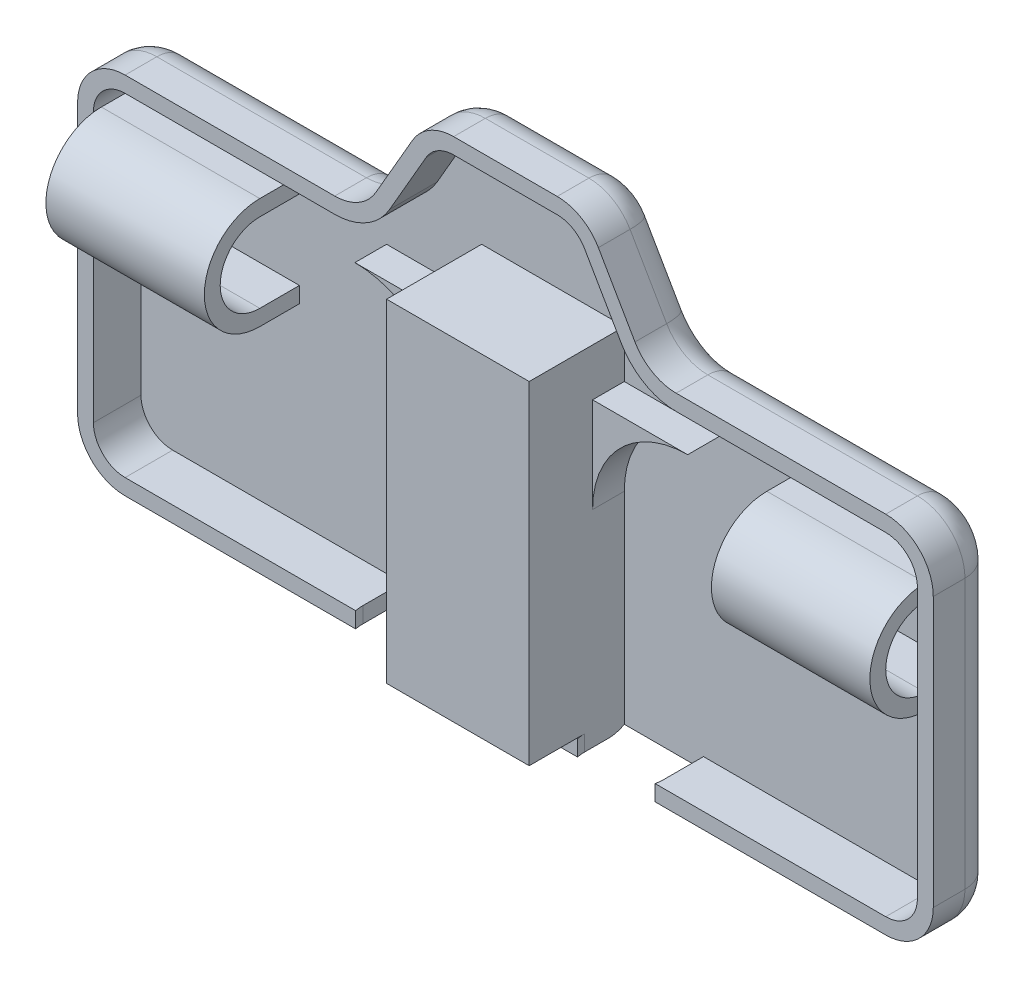
from build123d import *

# Parameters (mm, degrees)
BOSS_EXTRUDE1_DEPTH = 4
SHELL1_T            = -1
BOSS_EXTRUDE2_START = -26
BOSS_EXTRUDE2_DEPTH = 10
BOSS_EXTRUDE3_START = 16
BOSS_EXTRUDE3_DEPTH = 10
BOSS_EXTRUDE5_DEPTH = 2
SKETCH4_3_W         = 9
SKETCH4_3_H         = 21
BOSS_EXTRUDE6_DEPTH = 6
CUT_EXTRUDE1_REACH  = 35.47
FILLET1_R           = 2


with BuildPart() as part:
    # Sketch2 → Boss-Extrude1 (new body)
    with BuildSketch(Plane.XY):
        with BuildLine():
            Line((-3.267949192, 18.5), (3.267949192, 18.5))
            ThreePointArc((3.267949192, 18.5), (4.767949192, 18.098076211), (5.866025404, 17))
            Line((5.866025404, 17), (8.175426481, 13))
            ThreePointArc((8.175426481, 13), (9.273502692, 11.901923789), (10.773502692, 11.5))
            Line((10.773502692, 11.5), (24, 11.5))
            ThreePointArc((24, 11.5), (26.121320344, 10.621320344), (27, 8.5))
            Line((27, 8.5), (27, -8.5))
            ThreePointArc((27, -8.5), (26.121320344, -10.621320344), (24, -11.5))
            Line((24, -11.5), (-24, -11.5))
            ThreePointArc((-24, -11.5), (-26.121320344, -10.621320344), (-27, -8.5))
            Line((-27, -8.5), (-27, 8.5))
            ThreePointArc((-27, 8.5), (-26.121320344, 10.621320344), (-24, 11.5))
            Line((-24, 11.5), (-10.773502692, 11.5))
            ThreePointArc((-10.773502692, 11.5), (-9.273502692, 11.901923789), (-8.175426481, 13))
            Line((-8.175426481, 13), (-5.866025404, 17))
            ThreePointArc((-5.866025404, 17), (-4.767949192, 18.098076211), (-3.267949192, 18.5))
        make_face()
    extrude(amount=BOSS_EXTRUDE1_DEPTH)

    # Shell1
    shell1_openings = [part.faces().sort_by_distance(p)[0] for p in [
        (0, 1.077008716, 4),
    ]]
    offset(amount=SHELL1_T, openings=shell1_openings, kind=Kind.INTERSECTION)

    # Sketch3 → Boss-Extrude2 (add)
    with BuildSketch(Plane(origin=(0, 0, 0), x_dir=(0, 0, -1), z_dir=(1, 0, 0)).offset(BOSS_EXTRUDE2_START)):
        with BuildLine():
            Line((-1, 2.5), (-3.5, 2.5))
            ThreePointArc((-3.5, 2.5), (-6, 5), (-3.5, 7.5))
            Line((-3.5, 7.5), (-1, 7.5))
            Line((-1, 7.5), (-1, 8.5))
            Line((-1, 8.5), (-3.5, 8.5))
            ThreePointArc((-3.5, 8.5), (-7, 5), (-3.5, 1.5))
            Line((-3.5, 1.5), (-1, 1.5))
            Line((-1, 1.5), (-1, 2.5))
        make_face()
    extrude(amount=BOSS_EXTRUDE2_DEPTH)

    # Sketch3<3> → Boss-Extrude3 (add)
    with BuildSketch(Plane(origin=(0, 0, 0), x_dir=(0, 0, -1), z_dir=(1, 0, 0)).offset(BOSS_EXTRUDE3_START)):
        with BuildLine():
            Line((-6.672077255, 6.479163916), (-5.765769468, 6.056545654))
            ThreePointArc((-5.765769468, 6.056545654), (-4.843249021, 7.108478615), (-3.5, 7.5))
            Line((-3.5, 7.5), (-1, 7.5))
            Line((-1, 7.5), (-1, 8.5))
            Line((-1, 8.5), (-3.5, 8.5))
            ThreePointArc((-3.5, 8.5), (-5.380548629, 7.95187006), (-6.672077255, 6.479163916))
        make_face()
        with BuildLine():
            Line((-1, 2.5), (-3.5, 2.5))
            ThreePointArc((-3.5, 2.5), (-5.608478615, 3.656750979), (-5.765769468, 6.056545654))
            Line((-5.765769468, 6.056545654), (-6.672077255, 6.479163916))
            ThreePointArc((-6.672077255, 6.479163916), (-6.45187006, 3.119451371), (-3.5, 1.5))
            Line((-3.5, 1.5), (-1, 1.5))
            Line((-1, 1.5), (-1, 2.5))
        make_face()
    extrude(amount=BOSS_EXTRUDE3_DEPTH)

    # Sketch4 → Boss-Extrude5 (add)
    with BuildSketch(Plane.XY.offset(1)):
        with BuildLine():
            Line((-4.5, 1.5), (-4.5, 7.5))
            Line((-4.5, 7.5), (-10.5, 7.5))
            ThreePointArc((-10.5, 7.5), (-6.257359313, 5.742640687), (-4.5, 1.5))
        make_face()
        with BuildLine():
            Line((10.5, 7.5), (4.5, 7.5))
            Line((4.5, 7.5), (4.5, 1.5))
            ThreePointArc((4.5, 1.5), (6.257359313, 5.742640687), (10.5, 7.5))
        make_face()
    extrude(amount=BOSS_EXTRUDE5_DEPTH)

    # Sketch4<3> → Boss-Extrude6 (add)
    with BuildSketch(Plane.XY.offset(1)):
        Rectangle(SKETCH4_3_W, SKETCH4_3_H)
    extrude(amount=BOSS_EXTRUDE6_DEPTH)

    # Sketch5 → Cut-Extrude1 (cut, up to next)
    with BuildSketch(Plane(origin=(0, 0, 0), x_dir=(1, 0, 0), z_dir=(0, 1, 0)), mode=Mode.PRIVATE) as cut_extrude1_sk1:
        with BuildLine():
            Line((-9.5, -3.5), (-9.5, -1))
            Line((-9.5, -1), (-4.5, -1))
            Line((-4.5, -1), (-4.5, -3.5))
            ThreePointArc((-4.5, -3.5), (-7, -6), (-9.5, -3.5))
        make_face()
    cut_extrude1_tool1 = extrude(cut_extrude1_sk1.sketch, amount=-CUT_EXTRUDE1_REACH, mode=Mode.PRIVATE) & part.part
    # Sketch5 → Cut-Extrude1 (cut, up to next)
    with BuildSketch(Plane(origin=(0, 0, 0), x_dir=(1, 0, 0), z_dir=(0, 1, 0)), mode=Mode.PRIVATE) as cut_extrude1_sk2:
        with BuildLine():
            Line((4.5, -3.5), (4.5, -1))
            Line((4.5, -1), (9.5, -1))
            Line((9.5, -1), (9.5, -3.5))
            ThreePointArc((9.5, -3.5), (7, -6), (4.5, -3.5))
        make_face()
    cut_extrude1_tool2 = extrude(cut_extrude1_sk2.sketch, amount=-CUT_EXTRUDE1_REACH, mode=Mode.PRIVATE) & part.part
    add(cut_extrude1_tool1.solids().sort_by_distance((-7, 0, 3.266625))[0], mode=Mode.SUBTRACT)
    add(cut_extrude1_tool2.solids().sort_by_distance((7, 0, 3.266625))[0], mode=Mode.SUBTRACT)

    # Fillet1
    # the kernel refuses this fillet: 2 mm, written as the material it takes off along each edge
    with BuildSketch(Plane(origin=(27, 8.5, 0), x_dir=(0, 0, 1), z_dir=(0, -1, 0)), Plane(origin=(-27, -8.5, 0), x_dir=(0, 0, 1), z_dir=(0, 1, 0))) as fillet1_piece_1:
        with BuildLine():
            CenterArc((FILLET1_R, FILLET1_R), FILLET1_R, 180, 90)
            Line((0, FILLET1_R), (0, 0))
            Line((0, 0), (FILLET1_R, 0))
        make_face()
    extrude(amount=17, mode=Mode.SUBTRACT)
    with BuildSketch(Plane(origin=(24, 8.5, 0), x_dir=(0, 1, 0), z_dir=(-1, 0, 0))) as fillet1_piece_2:
        with BuildLine():
            CenterArc((3 - FILLET1_R, -FILLET1_R), FILLET1_R, 0, 90)
            Line((3 - FILLET1_R, 0), (3, 0))
            Line((3, 0), (3, -FILLET1_R))
        make_face()
    revolve(axis=Axis((24, 8.5, 0), (0, 0, -1)), revolution_arc=90, mode=Mode.SUBTRACT)
    with BuildSketch(Plane(origin=(10.773502692, 11.5, 0), x_dir=(0, 0, 1), z_dir=(1, 0, 0)), Plane(origin=(-24, 11.5, 0), x_dir=(0, 0, 1), z_dir=(1, 0, 0))) as fillet1_piece_3:
        with BuildLine():
            CenterArc((FILLET1_R, FILLET1_R), FILLET1_R, 180, 90)
            Line((0, FILLET1_R), (0, 0))
            Line((0, 0), (FILLET1_R, 0))
        make_face()
    extrude(amount=13.226497308, mode=Mode.SUBTRACT)
    with BuildSketch(Plane(origin=(10.773502692, 14.5, 0), x_dir=(-0.8660254037844389, -0.49999999999999956, 0), z_dir=(-0.49999999999999956, 0.8660254037844389, 0))) as fillet1_piece_4:
        with BuildLine():
            CenterArc((3 + FILLET1_R, FILLET1_R), FILLET1_R, 180, 90)
            Line((3 + FILLET1_R, 0), (3, 0))
            Line((3, 0), (3, FILLET1_R))
        make_face()
    revolve(axis=Axis((10.773502692, 14.5, 0), (0, 0, 1)), revolution_arc=60, mode=Mode.SUBTRACT)
    with BuildSketch(Plane(origin=(5.866025404, 17, 0), x_dir=(0, 0, 1), z_dir=(0.500000000000004, -0.8660254037844364, 0)), Plane(origin=(-8.175426481, 13, 0), x_dir=(0, 0, 1), z_dir=(0.5000000000000043, 0.8660254037844362, 0))) as fillet1_piece_5:
        with BuildLine():
            CenterArc((FILLET1_R, FILLET1_R), FILLET1_R, 180, 90)
            Line((0, FILLET1_R), (0, 0))
            Line((0, 0), (FILLET1_R, 0))
        make_face()
    extrude(amount=4.618802154, mode=Mode.SUBTRACT)
    with BuildSketch(Plane(origin=(3.267949192, 15.5, 0), x_dir=(0, 1, 0), z_dir=(-1, 0, 0))) as fillet1_piece_6:
        with BuildLine():
            CenterArc((3 - FILLET1_R, -FILLET1_R), FILLET1_R, 0, 90)
            Line((3 - FILLET1_R, 0), (3, 0))
            Line((3, 0), (3, -FILLET1_R))
        make_face()
    revolve(axis=Axis((3.267949192, 15.5, 0), (0, 0, -1)), revolution_arc=60, mode=Mode.SUBTRACT)
    with BuildSketch(Plane(origin=(-3.267949192, 18.5, 0), x_dir=(0, 0, 1), z_dir=(1, 0, 0))) as fillet1_piece_7:
        with BuildLine():
            CenterArc((FILLET1_R, FILLET1_R), FILLET1_R, 180, 90)
            Line((0, FILLET1_R), (0, 0))
            Line((0, 0), (FILLET1_R, 0))
        make_face()
    extrude(amount=6.535898385, mode=Mode.SUBTRACT)
    with BuildSketch(Plane(origin=(-3.267949192, 15.5, 0), x_dir=(-0.8660254037844407, 0.4999999999999964, 0), z_dir=(-0.4999999999999964, -0.8660254037844407, 0))) as fillet1_piece_8:
        with BuildLine():
            CenterArc((3 - FILLET1_R, -FILLET1_R), FILLET1_R, 0, 90)
            Line((3 - FILLET1_R, 0), (3, 0))
            Line((3, 0), (3, -FILLET1_R))
        make_face()
    revolve(axis=Axis((-3.267949192, 15.5, 0), (0, 0, -1)), revolution_arc=60, mode=Mode.SUBTRACT)
    with BuildSketch(Plane(origin=(-10.773502692, 14.5, 0), x_dir=(0, -1, 0), z_dir=(-1, 0, 0))) as fillet1_piece_9:
        with BuildLine():
            CenterArc((3 + FILLET1_R, FILLET1_R), FILLET1_R, 180, 90)
            Line((3, FILLET1_R), (3, 0))
            Line((3, 0), (3 + FILLET1_R, 0))
        make_face()
    revolve(axis=Axis((-10.773502692, 14.5, 0), (0, 0, 1)), revolution_arc=60, mode=Mode.SUBTRACT)
    with BuildSketch(Plane(origin=(-24, 8.5, 0), x_dir=(-1, 0, 0), z_dir=(0, -1, 0))) as fillet1_piece_10:
        with BuildLine():
            CenterArc((3 - FILLET1_R, -FILLET1_R), FILLET1_R, 0, 90)
            Line((3, -FILLET1_R), (3, 0))
            Line((3, 0), (3 - FILLET1_R, 0))
        make_face()
    revolve(axis=Axis((-24, 8.5, 0), (0, 0, -1)), revolution_arc=90, mode=Mode.SUBTRACT)
    with BuildSketch(Plane(origin=(-24, -8.5, 0), x_dir=(0, -1, 0), z_dir=(1, 0, 0))) as fillet1_piece_11:
        with BuildLine():
            CenterArc((3 - FILLET1_R, -FILLET1_R), FILLET1_R, 0, 90)
            Line((3 - FILLET1_R, 0), (3, 0))
            Line((3, 0), (3, -FILLET1_R))
        make_face()
    revolve(axis=Axis((-24, -8.5, 0), (0, 0, -1)), revolution_arc=90, mode=Mode.SUBTRACT)
    with BuildSketch(Plane(origin=(24, -11.5, 0), x_dir=(0, 0, 1), z_dir=(-1, 0, 0))) as fillet1_piece_12:
        with BuildLine():
            CenterArc((FILLET1_R, FILLET1_R), FILLET1_R, 180, 90)
            Line((0, FILLET1_R), (0, 0))
            Line((0, 0), (FILLET1_R, 0))
        make_face()
    extrude(amount=48, mode=Mode.SUBTRACT)
    with BuildSketch(Plane(origin=(24, -8.5, 0), x_dir=(1, 0, 0), z_dir=(0, 1, 0))) as fillet1_piece_13:
        with BuildLine():
            CenterArc((3 - FILLET1_R, -FILLET1_R), FILLET1_R, 0, 90)
            Line((3 - FILLET1_R, 0), (3, 0))
            Line((3, 0), (3, -FILLET1_R))
        make_face()
    revolve(axis=Axis((24, -8.5, 0), (0, 0, -1)), revolution_arc=90, mode=Mode.SUBTRACT)


solid = part.part
